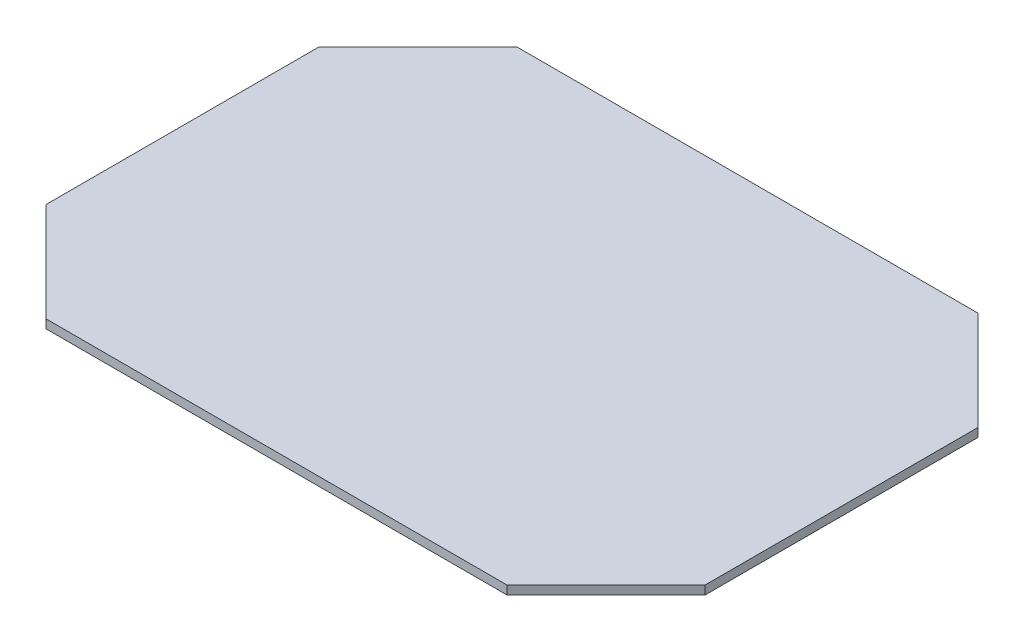
from build123d import *

# Parameters (mm, degrees)
BOSS_EXTRUDE2_DEPTH = 3


with BuildPart() as part:
    # Sketch1 → Boss-Extrude2 (new body)
    with BuildSketch(Plane(origin=(0, 0, 0), x_dir=(1, 0, 0), z_dir=(0, 1, 0))):
        Polygon((1.863961031, 167.216384464), (161.186038969, 167.216384464), (195.383192232, 133.019231201), (195.383192232, 38.697153263), (161.186038969, 4.5), (1.863961031, 4.5), (-32.333192232, 38.697153263), (-32.333192232, 133.019231201), align=None)
    extrude(amount=BOSS_EXTRUDE2_DEPTH)


solid = part.part
